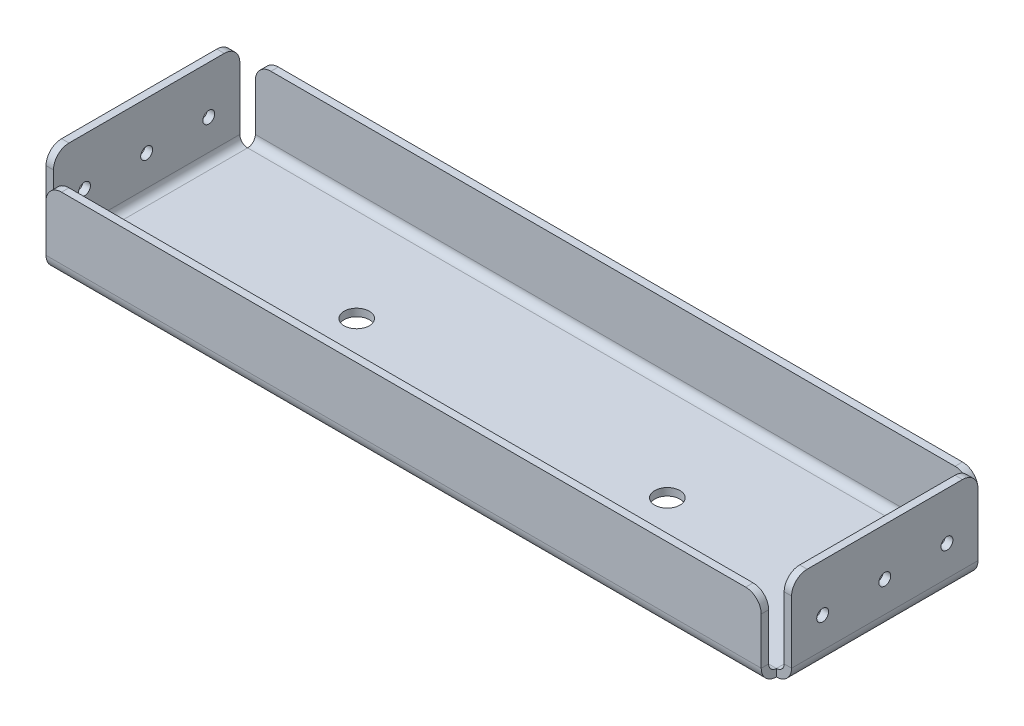
from build123d import *

# Parameters (mm, degrees)
SKETCH1_W                      = 304.8
SKETCH1_H                      = 76.2
BASE_FLANGE1_DEPTH             = 3.03784
EDGE_FLANGE1_STRIP_W           = 18.50136
EDGE_FLANGE1_STRIP_H           = 3.03784
EDGE_FLANGE1_STRIP_CUT_DEPTH   = 76.2
EDGE_FLANGE1_STRIP_2_W         = 18.50136
EDGE_FLANGE1_STRIP_2_H         = 3.03784
EDGE_FLANGE1_STRIP_CUT_2_DEPTH = 76.2
EDGE_FLANGE1_DEPTH             = 76.2
EDGE_FLANGE1_BEND_DEPTH        = 76.2
EDGE_FLANGE2_DEPTH             = 292.37432
EDGE_FLANGE2_BEND_DEPTH        = 292.37432
F_3_8_CLEARANCE_HOLE1_D        = 10.31748
F_11_0_191_DIAMETER_HOLE1_D    = 4.8514
FILLET1_R                      = 6.35


# Sheet-metal steps are written as plain solids
with BuildPart() as part:
    # Sketch1 → Base-Flange1 (new body)
    with BuildSketch(Plane(origin=(0, 0, 0), x_dir=(1, 0, 0), z_dir=(0, 1, 0))):
        with Locations((152.4, 38.1)):
            Rectangle(SKETCH1_W, SKETCH1_H)
    extrude(amount=-BASE_FLANGE1_DEPTH)

    # Edge-Flange1 strip (across the edge) → Edge-Flange1 strip cut (cut)
    with BuildSketch(Plane.XY.offset(-76.2)):
        with Locations((-3.03784, -1.51892)):
            Rectangle(EDGE_FLANGE1_STRIP_W, EDGE_FLANGE1_STRIP_H)
    extrude(amount=EDGE_FLANGE1_STRIP_CUT_DEPTH, mode=Mode.SUBTRACT)

    # Edge-Flange1 strip 2 (across the edge) → Edge-Flange1 strip cut 2 (cut)
    with BuildSketch(Plane(origin=(304.8, 0, 0), x_dir=(-1, 0, 0), z_dir=(0, 0, -1))):
        with Locations((-3.03784, -1.51892)):
            Rectangle(EDGE_FLANGE1_STRIP_2_W, EDGE_FLANGE1_STRIP_2_H)
    extrude(amount=EDGE_FLANGE1_STRIP_CUT_2_DEPTH, mode=Mode.SUBTRACT)

    # Edge-Flange1 section (across the edge) → Edge-Flange1 (add)
    with BuildSketch(Plane.XY.offset(-76.2)):
        with BuildLine():
            Line((0, 3.175), (0, 35.06216))
            Line((0, 35.06216), (3.03784, 35.06216))
            Line((3.03784, 35.06216), (3.03784, 3.175))
            ThreePointArc((3.03784, 3.175), (3.96777597, 0.92993597), (6.21284, 0))
            Line((6.21284, 0), (6.21284, -3.03784))
            ThreePointArc((6.21284, -3.03784), (1.819698706, -1.218141294), (0, 3.175))
        make_face()
    extrude(amount=EDGE_FLANGE1_DEPTH)

    # Edge-Flange1 section 2 (across the edge) → Edge-Flange1 bend (add)
    with BuildSketch(Plane(origin=(304.8, 0, 0), x_dir=(-1, 0, 0), z_dir=(0, 0, -1))):
        with BuildLine():
            Line((0, 3.175), (0, 35.06216))
            Line((0, 35.06216), (3.03784, 35.06216))
            Line((3.03784, 35.06216), (3.03784, 3.175))
            ThreePointArc((3.03784, 3.175), (3.96777597, 0.92993597), (6.21284, 0))
            Line((6.21284, 0), (6.21284, -3.03784))
            ThreePointArc((6.21284, -3.03784), (1.819698706, -1.218141294), (0, 3.175))
        make_face()
    extrude(amount=EDGE_FLANGE1_BEND_DEPTH)

    # Edge-Flange2 section (across the edge) → Edge-Flange2 (add)
    with BuildSketch(Plane(origin=(6.21284, 0, 3.175), x_dir=(0, 0, -1), z_dir=(1, 0, 0))):
        with BuildLine():
            Line((-3.03784, 3.175), (-3.03784, 28.71216))
            Line((-3.03784, 28.71216), (0, 28.71216))
            Line((0, 28.71216), (0, 3.175))
            ThreePointArc((0, 3.175), (0.92993597, 0.92993597), (3.175, 0))
            Line((3.175, 0), (3.175, -3.03784))
            ThreePointArc((3.175, -3.03784), (-1.218141294, -1.218141294), (-3.03784, 3.175))
        make_face()
    extrude(amount=EDGE_FLANGE2_DEPTH)

    # Edge-Flange2 section 2 (across the edge) → Edge-Flange2 bend (add)
    with BuildSketch(Plane(origin=(298.58716, 0, -79.375), x_dir=(0, 0, 1), z_dir=(-1, 0, 0))):
        with BuildLine():
            Line((-3.03784, 3.175), (-3.03784, 28.71216))
            Line((-3.03784, 28.71216), (0, 28.71216))
            Line((0, 28.71216), (0, 3.175))
            ThreePointArc((0, 3.175), (0.92993597, 0.92993597), (3.175, 0))
            Line((3.175, 0), (3.175, -3.03784))
            ThreePointArc((3.175, -3.03784), (-1.218141294, -1.218141294), (-3.03784, 3.175))
        make_face()
    extrude(amount=EDGE_FLANGE2_BEND_DEPTH)

    # 3/8 Clearance Hole1 (through all)
    with Locations(Plane(origin=(0, -3.03784, 0), x_dir=(-1, 0, 0), z_dir=(0, -1, 0))):
        with Locations((-88.9, 38.1), (-215.9, 38.1)):
            Hole(F_3_8_CLEARANCE_HOLE1_D / 2)

    # #11 (0.191) Diameter Hole1 (through all)
    with Locations(Plane(origin=(304.8, 0, 0), x_dir=(0, 0, -1), z_dir=(1, 0, 0))):
        with Locations((12.7, 15.6337), (38.1, 15.6337), (63.5, 15.6337)):
            Hole(F_11_0_191_DIAMETER_HOLE1_D / 2)

    # Fillet1
    fillet1_edges = [part.edges().sort_by_distance(p)[0] for p in [
        (1.51892, 35.06216, 0),
        (6.21284, 28.71216, 4.69392),
        (1.51892, 35.06216, -76.2),
        (298.58716, 28.71216, 4.69392),
        (6.21284, 28.71216, -80.89392),
        (303.28108, 35.06216, 0),
        (298.58716, 28.71216, -80.89392),
        (303.28108, 35.06216, -76.2),
    ]]
    fillet(fillet1_edges, radius=FILLET1_R)


solid = part.part
